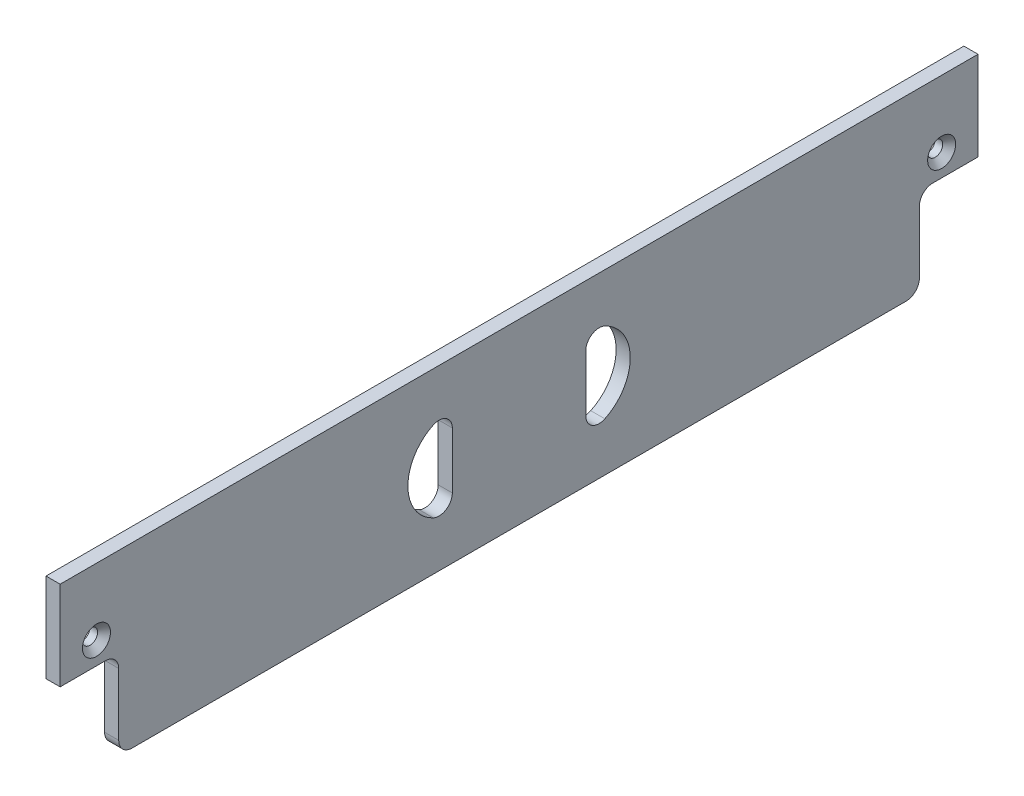
from build123d import *

# Parameters (mm, degrees)
BOSS_EXTRUDE1_DEPTH                             = 3.175
CSK_FOR_M3_FLAT_HEAD_MACHINE_SCREW1_D           = 3.4
CSK_FOR_M3_FLAT_HEAD_MACHINE_SCREW1_CSINK_D     = 6.3
CSK_FOR_M3_FLAT_HEAD_MACHINE_SCREW1_CSINK_ANGLE = 90
CUT_EXTRUDE1_DEPTH                              = 111.703031801
FILLET1_R                                       = 3
FILLET1_OF_MIRROR3_R                            = 3


with BuildPart() as part:
    # Sketch1 → Boss-Extrude1 (new body)
    with BuildSketch(Plane(origin=(0, 0, 0), x_dir=(0, 0, -1), z_dir=(1, 0, 0))):
        with BuildLine():
            Line((-103.175, 20), (-103.175, 40))
            Line((-103.175, 40), (103.175, 40))
            Line((103.175, 40), (103.175, 20))
            Line((103.175, 20), (93, 20))
            ThreePointArc((93, 20), (90.878679656, 19.121320344), (90, 17))
            Line((90, 17), (90, 3))
            ThreePointArc((90, 3), (89.121320344, 0.878679656), (87, 0))
            Line((87, 0), (-87, 0))
            ThreePointArc((-87, 0), (-89.121320344, 0.878679656), (-90, 3))
            Line((-90, 3), (-90, 17))
            ThreePointArc((-90, 17), (-90.878679656, 19.121320344), (-93, 20))
            Line((-93, 20), (-103.175, 20))
        make_face()
    extrude(amount=BOSS_EXTRUDE1_DEPTH)

    # CSK for M3 Flat Head Machine Screw1 (through all)
    with Locations(Plane(origin=(3.175, 0, 0), x_dir=(0, 0, -1), z_dir=(1, 0, 0))):
        with Locations((-95, 25)):
            csk_for_m3_flat_head_machine_screw1 = CounterSinkHole(CSK_FOR_M3_FLAT_HEAD_MACHINE_SCREW1_D / 2, CSK_FOR_M3_FLAT_HEAD_MACHINE_SCREW1_CSINK_D / 2, counter_sink_angle=CSK_FOR_M3_FLAT_HEAD_MACHINE_SCREW1_CSINK_ANGLE)

    # Mirror1: CSK for M3 Flat Head Machine Screw1 across plane
    add(csk_for_m3_flat_head_machine_screw1.mirror(Plane.XY), mode=Mode.SUBTRACT)

    # Sketch4 → Cut-Extrude1 (cut, through all)
    with BuildSketch(Plane(origin=(3.175, 0, 0), x_dir=(0, 0, -1), z_dir=(1, 0, 0))):
        with BuildLine():
            Line((-15, 30), (-15, 10))
            ThreePointArc((-15, 10), (-25, 20), (-15, 30))
        make_face()
    cut_extrude1 = extrude(amount=-CUT_EXTRUDE1_DEPTH, mode=Mode.SUBTRACT)

    # Fillet1
    fillet1_edges = [part.edges().sort_by_distance(p)[0] for p in [
        (1.5875, 30, 15),
        (1.5875, 10, 15),
    ]]
    fillet(fillet1_edges, radius=FILLET1_R)

    # Mirror3: Cut-Extrude1 across plane
    add(cut_extrude1.mirror(Plane.XY), mode=Mode.SUBTRACT)

    # Fillet1 of Mirror3
    fillet1_of_mirror3_edges = [part.edges().sort_by_distance(p)[0] for p in [
        (1.5875, 30, -15),
        (1.5875, 10, -15),
    ]]
    fillet(fillet1_of_mirror3_edges, radius=FILLET1_OF_MIRROR3_R)


solid = part.part
